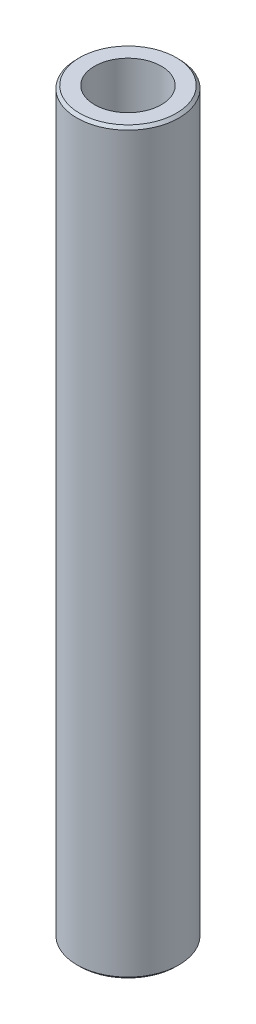
from build123d import *
from OCP.BRepFilletAPI import BRepFilletAPI_MakeChamfer

# Parameters (mm, degrees)
SKETCH1_R           = 15
BOSS_EXTRUDE1_DEPTH = 217.322162524
SKETCH2_R           = 9.829679305
CUT_EXTRUDE1_DEPTH  = 219.355037323
CHAMFER1_SIZE       = 0.802296838
CHAMFER1_SIZE2      = 0.794101076


with BuildPart() as part:
    # Sketch1 → Boss-Extrude1 (new body)
    with BuildSketch(Plane(origin=(0, 0, 0), x_dir=(1, 0, 0), z_dir=(0, 1, 0))):
        Circle(SKETCH1_R)
    extrude(amount=BOSS_EXTRUDE1_DEPTH)

    # Sketch2 → Cut-Extrude1 (cut, through all)
    with BuildSketch(Plane(origin=(0, 0, 0), x_dir=(1, 0, 0), z_dir=(0, 1, 0))):
        Circle(SKETCH2_R)
    extrude(amount=CUT_EXTRUDE1_DEPTH, mode=Mode.SUBTRACT)

    # Chamfer1: one chamfer whose edges measure the first distance from different faces: ONE call of the kernel's chamfer builder (chamfer() names one face for all edges)
    chamfer1_edges_1 = [part.edges().sort_by_distance(p)[0] for p in [
        (-15, 217.322162524, 0),
    ]]
    chamfer1_side_1 = [part.faces().sort_by_distance(p)[0] for p in [
        (-15, 108.661081262, 0),
    ]]
    chamfer1_edges_2 = [part.edges().sort_by_distance(p)[0] for p in [
        (-15, 0, 0),
    ]]
    chamfer1_side_2 = [part.faces().sort_by_distance(p)[0] for p in [
        (-14.575735931, 0, 0),
    ]]
    chamfer1 = BRepFilletAPI_MakeChamfer(part.part.solid().wrapped)
    for e in chamfer1_edges_1:
        chamfer1.Add(CHAMFER1_SIZE, CHAMFER1_SIZE2, e.wrapped, chamfer1_side_1[0].wrapped)  # the first distance lies on this face
    for e in chamfer1_edges_2:
        chamfer1.Add(CHAMFER1_SIZE, CHAMFER1_SIZE2, e.wrapped, chamfer1_side_2[0].wrapped)  # the first distance lies on this face
    add(Compound.cast(chamfer1.Shape()), mode=Mode.REPLACE)


solid = part.part
